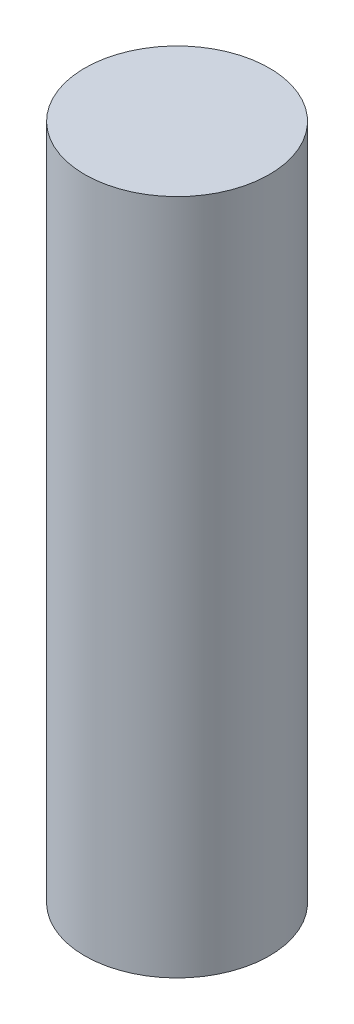
from build123d import *

# Parameters (mm, degrees)
EXTRUDE_1_DEPTH      = 1000
EXTRUDE_1_DEPTH_BACK = 100
SKETCH_2_R           = 150


with BuildPart() as part:
    # 草图2 → 凸台-拉伸1 (new, two sides: drawn at the far end of the back side and taken through both)
    with BuildSketch(Plane(origin=(0, 0, 0), x_dir=(1, 0, 0), z_dir=(0, 1, 0)).offset(-EXTRUDE_1_DEPTH_BACK)):
        Circle(SKETCH_2_R)
    extrude(amount=EXTRUDE_1_DEPTH + EXTRUDE_1_DEPTH_BACK)


solid = part.part
